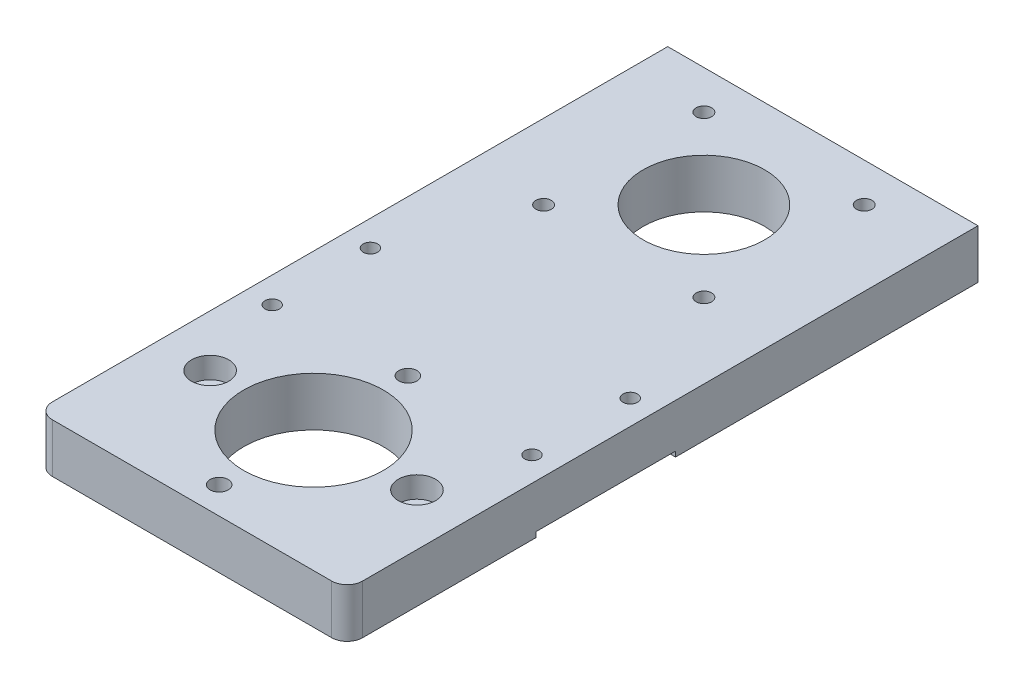
from build123d import *

# Parameters (mm, degrees)
SKETCH_1_W           = 60
SKETCH_1_H           = 63
EXTRUDE_1_DEPTH      = 9.5
FILLET_1_R           = 3
SKETCH_3_R           = 13.5
CUT_EXTRUDE_2_DEPTH  = 47.221542112
SKETCH_5_R           = 1.4
CUT_EXTRUDE_4_DEPTH  = 47.221542112
SKETCH_7_R           = 4
CUT_EXTRUDE_6_DEPTH  = 1
SKETCH_8_R           = 2
CUT_EXTRUDE_7_DEPTH  = 47.221542112
SKETCH_9_R           = 3.6
CUT_EXTRUDE_8_DEPTH  = 4.1
SKETCH_10_R          = 1.75
CUT_EXTRUDE_9_DEPTH  = 47.221542112
SKETCH_11_W          = 60
SKETCH_11_H          = 9.5
EXTRUDE_2_DEPTH      = 59
SKETCH_12_R          = 11.75
CUT_EXTRUDE_10_DEPTH = 94.642420836
SKETCH_13_R          = 1.5
CUT_EXTRUDE_11_DEPTH = 94.642420836
SKETCH_14_W          = 9.5
SKETCH_14_H          = 27
CUT_EXTRUDE_12_DEPTH = 1


with BuildPart() as part:
    # 草图1 → 凸台-拉伸1 (new body)
    with BuildSketch(Plane(origin=(0, 0, 0), x_dir=(1, 0, 0), z_dir=(0, 1, 0))):
        with Locations((0.04232978, -2.317737604)):
            Rectangle(SKETCH_1_W, SKETCH_1_H)
    extrude(amount=EXTRUDE_1_DEPTH)

    # 圆角1
    fillet_1_edges = [part.edges().sort_by_distance(p)[0] for p in [
        (30.04232978, 4.75, 33.817737604),
        (-29.95767022, 4.75, 33.817737604),
    ]]
    fillet(fillet_1_edges, radius=FILLET_1_R)

    # 草图3 → 切除-拉伸2 (cut, through all)
    with BuildSketch(Plane(origin=(0, 9.5, 0), x_dir=(1, 0, 0), z_dir=(0, 1, 0))):
        with Locations((0.04232978, -10.317737604)):
            Circle(SKETCH_3_R)
    extrude(amount=-CUT_EXTRUDE_2_DEPTH, mode=Mode.SUBTRACT)

    # 草图5 → 切除-拉伸4 (cut, through all)
    with BuildSketch(Plane(origin=(0, 9.5, 0), x_dir=(1, 0, 0), z_dir=(0, 1, 0))):
        with Locations((25.29232978, 25.685184597)):
            Circle(SKETCH_5_R)
        with Locations((25.29232978, 6.685184597)):
            Circle(SKETCH_5_R)
        with Locations((-24.95767022, 25.685184597)):
            Circle(SKETCH_5_R)
        with Locations((-24.95767022, 6.685184597)):
            Circle(SKETCH_5_R)
    extrude(amount=-CUT_EXTRUDE_4_DEPTH, mode=Mode.SUBTRACT)

    # 草图7 → 切除-拉伸6 (cut)
    with BuildSketch(Plane.XZ):
        with Locations((-19.95767022, 10.314815403)):
            Circle(SKETCH_7_R)
        with Locations((20.04232978, 10.314815403)):
            Circle(SKETCH_7_R)
    extrude(amount=-CUT_EXTRUDE_6_DEPTH, mode=Mode.SUBTRACT)

    # 草图8 → 切除-拉伸7 (cut, through all)
    with BuildSketch(Plane(origin=(0, 9.5, 0), x_dir=(1, 0, 0), z_dir=(0, 1, 0))):
        with Locations((-19.95767022, -10.314815403)):
            Circle(SKETCH_8_R)
        with Locations((20.04232978, -10.314815403)):
            Circle(SKETCH_8_R)
    extrude(amount=-CUT_EXTRUDE_7_DEPTH, mode=Mode.SUBTRACT)

    # 草图9 → 切除-拉伸8 (cut)
    with BuildSketch(Plane(origin=(0, 9.5, 0), x_dir=(1, 0, 0), z_dir=(0, 1, 0))):
        with Locations((-19.95767022, -10.314815403)):
            Circle(SKETCH_9_R)
        with Locations((20.04232978, -10.314815403)):
            Circle(SKETCH_9_R)
    extrude(amount=-CUT_EXTRUDE_8_DEPTH, mode=Mode.SUBTRACT)

    # 草图10 → 切除-拉伸9 (cut, through all)
    with BuildSketch(Plane(origin=(0, 9.5, 0), x_dir=(1, 0, 0), z_dir=(0, 1, 0))):
        with Locations((0.04232978, 7.932262396)):
            Circle(SKETCH_10_R)
        with Locations((0.04232978, -28.567737604)):
            Circle(SKETCH_10_R)
    extrude(amount=-CUT_EXTRUDE_9_DEPTH, mode=Mode.SUBTRACT)

    # 草图11 → 凸台-拉伸2 (add)
    with BuildSketch(Plane(origin=(0, 0, -29.182262396), x_dir=(-1, 0, 0), z_dir=(0, 0, -1))):
        with Locations((-0.04232978, 4.75)):
            Rectangle(SKETCH_11_W, SKETCH_11_H)
    extrude(amount=EXTRUDE_2_DEPTH)

    # 草图12 → 切除-拉伸10 (cut, through all)
    with BuildSketch(Plane.XZ):
        with Locations((0.033863824, -65.183068008)):
            Circle(SKETCH_12_R)
    extrude(amount=-CUT_EXTRUDE_10_DEPTH, mode=Mode.SUBTRACT)

    # 草图13 → 切除-拉伸11 (cut, through all)
    with BuildSketch(Plane.XZ):
        with Locations((-15.466136176, -49.683068008)):
            Circle(SKETCH_13_R)
        with Locations((-15.466136176, -80.683068008)):
            Circle(SKETCH_13_R)
        with Locations((15.533863824, -80.683068008)):
            Circle(SKETCH_13_R)
        with Locations((15.533863824, -49.683068008)):
            Circle(SKETCH_13_R)
    extrude(amount=-CUT_EXTRUDE_11_DEPTH, mode=Mode.SUBTRACT)

    # 草图14 → 切除-拉伸12 (cut)
    with BuildSketch(Plane.XZ):
        with Locations((25.29232978, -16.185184597)):
            Rectangle(SKETCH_14_W, SKETCH_14_H)
        with Locations((-25.20767022, -16.185184597)):
            Rectangle(SKETCH_14_W, SKETCH_14_H)
    extrude(amount=-CUT_EXTRUDE_12_DEPTH, mode=Mode.SUBTRACT)


solid = part.part
